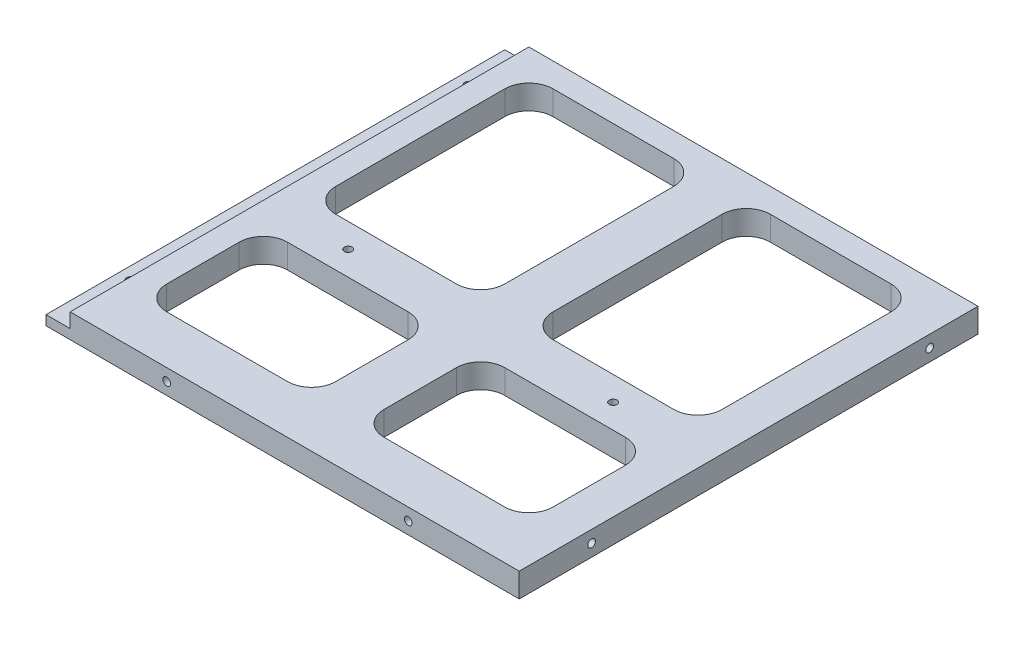
from build123d import *

# Parameters (mm, degrees)
SKETCH1_W                             = 98
SKETCH1_H                             = 95
BOSS_EXTRUDE1_DEPTH                   = 5
SKETCH6_W                             = 5
SKETCH6_H                             = 95
CUT_EXTRUDE1_DEPTH                    = 3
CUT_EXTRUDE2_DEPTH                    = 137.579647093
TAP_DRILL_FOR_M2X0_4_TAP4_D           = 1.6
TAP_DRILL_FOR_M2X0_4_TAP1_D           = 1.6
TAP_DRILL_FOR_M2X0_4_TAP1_CSINK_D     = 3.8
TAP_DRILL_FOR_M2X0_4_TAP1_CSINK_ANGLE = 90
TAP_DRILL_FOR_M2X0_4_TAP3_D           = 1.6
TAP_DRILL_FOR_M2X0_4_TAP3_DEPTH       = 6
TAP_DRILL_FOR_M2X0_4_TAP3_TIP         = 0.480688495
TAP_DRILL_FOR_M2X0_4_TAP5_D           = 1.6
TAP_DRILL_FOR_M2X0_4_TAP5_DEPTH       = 4
TAP_DRILL_FOR_M2X0_4_TAP5_TIP         = 0.480688495
TAP_DRILL_FOR_M2X0_4_TAP6_D           = 1.6
TAP_DRILL_FOR_M2X0_4_TAP6_DEPTH       = 7
TAP_DRILL_FOR_M2X0_4_TAP6_TIP         = 0.480688495


with BuildPart() as part:
    # Sketch1 → Boss-Extrude1 (new body)
    with BuildSketch(Plane(origin=(0, 0, 0), x_dir=(1, 0, 0), z_dir=(0, 1, 0))):
        with Locations((49, 47.5)):
            Rectangle(SKETCH1_W, SKETCH1_H)
    extrude(amount=BOSS_EXTRUDE1_DEPTH)

    # Sketch6 → Cut-Extrude1 (cut)
    with BuildSketch(Plane(origin=(0, 5, 0), x_dir=(1, 0, 0), z_dir=(0, 1, 0))):
        with Locations((2.5, 47.5)):
            Rectangle(SKETCH6_W, SKETCH6_H)
    extrude(amount=-CUT_EXTRUDE1_DEPTH, mode=Mode.SUBTRACT)

    # Sketch5 → Cut-Extrude2 (cut, through all)
    with BuildSketch(Plane(origin=(0, 5, 0), x_dir=(1, 0, 0), z_dir=(0, 1, 0))):
        with BuildLine():
            Line((15, 90), (40, 90))
            ThreePointArc((40, 90), (43.535533906, 88.535533906), (45, 85))
            Line((45, 85), (45, 50))
            ThreePointArc((45, 50), (43.535533906, 46.464466094), (40, 45))
            Line((40, 45), (15, 45))
            ThreePointArc((15, 45), (11.464466094, 46.464466094), (10, 50))
            Line((10, 50), (10, 85))
            ThreePointArc((10, 85), (11.464466094, 88.535533906), (15, 90))
        make_face()
        with BuildLine():
            Line((60, 90), (85, 90))
            ThreePointArc((85, 90), (88.535533906, 88.535533906), (90, 85))
            Line((90, 85), (90, 50))
            ThreePointArc((90, 50), (88.535533906, 46.464466094), (85, 45))
            Line((85, 45), (60, 45))
            ThreePointArc((60, 45), (56.464466094, 46.464466094), (55, 50))
            Line((55, 50), (55, 85))
            ThreePointArc((55, 85), (56.464466094, 88.535533906), (60, 90))
        make_face()
        with BuildLine():
            Line((60, 35), (85, 35))
            ThreePointArc((85, 35), (88.535533906, 33.535533906), (90, 30))
            Line((90, 30), (90, 15))
            ThreePointArc((90, 15), (88.535533906, 11.464466094), (85, 10))
            Line((85, 10), (60, 10))
            ThreePointArc((60, 10), (56.464466094, 11.464466094), (55, 15))
            Line((55, 15), (55, 30))
            ThreePointArc((55, 30), (56.464466094, 33.535533906), (60, 35))
        make_face()
        with BuildLine():
            Line((15, 35), (40, 35))
            ThreePointArc((40, 35), (43.535533906, 33.535533906), (45, 30))
            Line((45, 30), (45, 15))
            ThreePointArc((45, 15), (43.535533906, 11.464466094), (40, 10))
            Line((40, 10), (15, 10))
            ThreePointArc((15, 10), (11.464466094, 11.464466094), (10, 15))
            Line((10, 15), (10, 30))
            ThreePointArc((10, 30), (11.464466094, 33.535533906), (15, 35))
        make_face()
    extrude(amount=-CUT_EXTRUDE2_DEPTH, mode=Mode.SUBTRACT)

    # Tap Drill for M2x0.4 Tap4 (through all)
    with Locations(Plane(origin=(22.568, 5, -40), x_dir=(0, 0, 1), z_dir=(0, 1, 0))):
        with Locations((0, 0), (0, 54.864)):
            Hole(TAP_DRILL_FOR_M2X0_4_TAP4_D / 2)

    # Tap Drill for M2x0.4 Tap1 (through all)
    with Locations(Plane(origin=(2.5, 0, -15), x_dir=(0, 0, -1), z_dir=(0, -1, 0))):
        with Locations((0, 0), (70, 0)):
            CounterSinkHole(TAP_DRILL_FOR_M2X0_4_TAP1_D / 2, TAP_DRILL_FOR_M2X0_4_TAP1_CSINK_D / 2, counter_sink_angle=TAP_DRILL_FOR_M2X0_4_TAP1_CSINK_ANGLE)

    # Tap Drill for M2x0.4 Tap3
    with Locations(Plane(origin=(98, 2.5, -15), x_dir=(0, 0, 1), z_dir=(1, 0, 0))):
        with Locations((0, 0), (-70, 0)):
            Hole(TAP_DRILL_FOR_M2X0_4_TAP3_D / 2, depth=TAP_DRILL_FOR_M2X0_4_TAP3_DEPTH)
            with Locations((0, 0, -(TAP_DRILL_FOR_M2X0_4_TAP3_DEPTH + TAP_DRILL_FOR_M2X0_4_TAP3_TIP / 2))):  # 118° drill point
                Cone(0, TAP_DRILL_FOR_M2X0_4_TAP3_D / 2, TAP_DRILL_FOR_M2X0_4_TAP3_TIP, mode=Mode.SUBTRACT)

    # Tap Drill for M2x0.4 Tap5
    with Locations(Plane(origin=(92.75, 2.5, -95), x_dir=(-1, 0, 0), z_dir=(0, 0, -1))):
        with Locations((0, 0), (85.5, 0)):
            Hole(TAP_DRILL_FOR_M2X0_4_TAP5_D / 2, depth=TAP_DRILL_FOR_M2X0_4_TAP5_DEPTH)
            with Locations((0, 0, -(TAP_DRILL_FOR_M2X0_4_TAP5_DEPTH + TAP_DRILL_FOR_M2X0_4_TAP5_TIP / 2))):  # 118° drill point
                Cone(0, TAP_DRILL_FOR_M2X0_4_TAP5_D / 2, TAP_DRILL_FOR_M2X0_4_TAP5_TIP, mode=Mode.SUBTRACT)

    # Tap Drill for M2x0.4 Tap6
    with Locations(Plane(origin=(25, 2.5, 0), x_dir=(1, 0, 0), z_dir=(0, 0, 1))):
        with Locations((0, 0), (50, 0)):
            Hole(TAP_DRILL_FOR_M2X0_4_TAP6_D / 2, depth=TAP_DRILL_FOR_M2X0_4_TAP6_DEPTH)
            with Locations((0, 0, -(TAP_DRILL_FOR_M2X0_4_TAP6_DEPTH + TAP_DRILL_FOR_M2X0_4_TAP6_TIP / 2))):  # 118° drill point
                Cone(0, TAP_DRILL_FOR_M2X0_4_TAP6_D / 2, TAP_DRILL_FOR_M2X0_4_TAP6_TIP, mode=Mode.SUBTRACT)


solid = part.part
